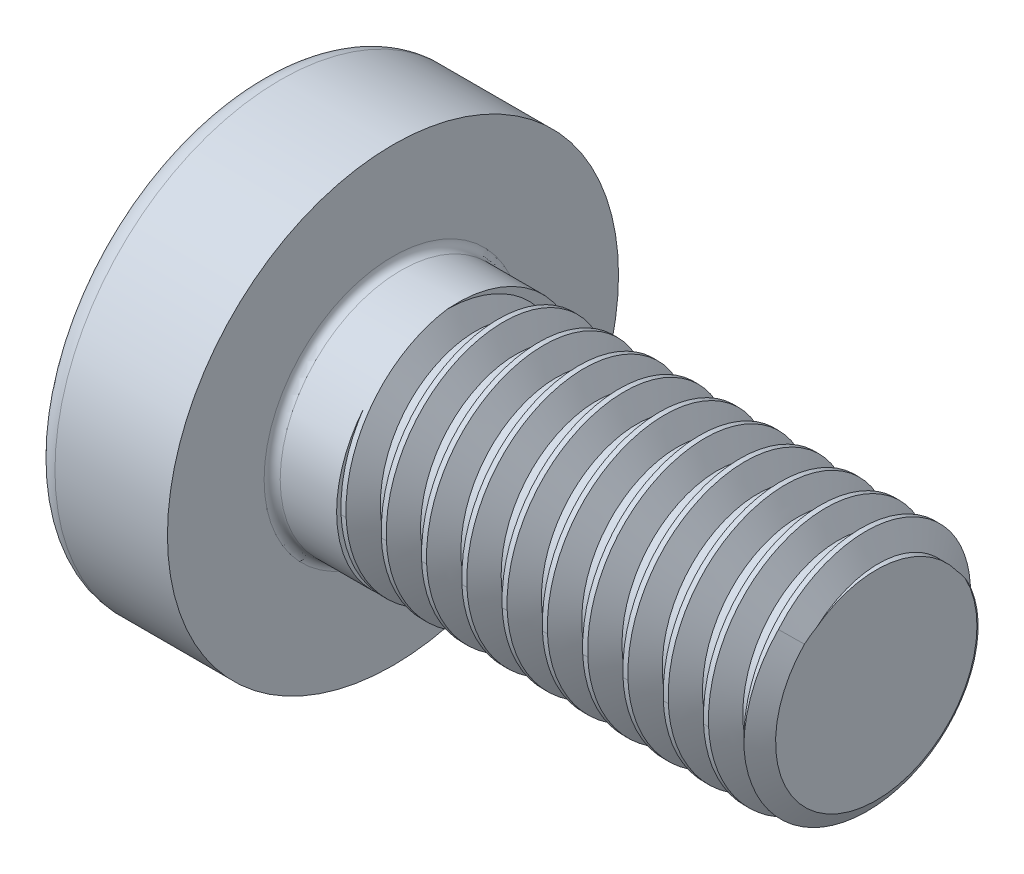
from build123d import *

# Parameters (mm, degrees)
FILLET1_R           = 0.1
CIRPATTERN1_COUNT   = 2
CIRPATTERN1_ANGLE   = 90.0000000000002
CHAMFER1_SIZE       = 0.25
CHAMFER1_SIZE2      = 0.14433756729740682
THREAD1_PITCH       = 0.5
BOSS_EXTRUDE1_START = 0.8
SKETCH8_R           = 1.5
BOSS_EXTRUDE1_DEPTH = 0.8


with BuildPart() as part:
    # Sketch2 → Revolve1 (revolve)
    with BuildSketch(Plane.XZ):
        with BuildLine():
            Line((0, 0), (-8.4, -1.08e-15))
            ThreePointArc((-8.4, -1.08e-15), (-8.20224645376158, 1.3922747564092113), (-7.624628401066268, 2.6744186046511635))
            ThreePointArc((-7.624628401066268, 2.6744186046511635), (-7.5267040293947, 2.766530149511446), (-7.396498467408688, 2.8))
            Line((-7.396498467408688, 2.8), (-6, 2.8000000000000003))
            Line((-6, 2.8000000000000003), (-6, 1.4999999999999991))
            Line((-6, 1.4999999999999991), (0, 1.5))
            Line((0, 1.5), (0, 0))
        make_face()
    revolve(axis=Axis((-2.352039512005497, 0, 0), (1, 0, 0)))

    # Fillet1
    fillet1_edges = [part.edges().sort_by_distance(p)[0] for p in [
        (-6, -1.8e-16, -1.4999999999999991),
    ]]
    fillet(fillet1_edges, radius=FILLET1_R)

    # Sketch3 → Cut-Loft1 section 0
    with BuildSketch(Plane(origin=(-8.4, 0, 0), x_dir=(0, 0, -1), z_dir=(1, 0, 0))):
        with BuildLine():
            Line((-0.3700000000000001, 1.4), (0.3699999999999999, 1.4))
            Line((0.3699999999999999, 1.4), (0.3700000000000002, -1.4))
            Line((0.3700000000000002, -1.4), (-0.3699999999999998, -1.4))
            Line((-0.3699999999999998, -1.4), (-0.3700000000000001, 1.4))
        make_face()
    # Sketch4 → Cut-Loft1 section 1
    with BuildSketch(Plane(origin=(-6.6499999999999995, 0, 0), x_dir=(0, 0, -1), z_dir=(1, 0, 0))):
        with BuildLine():
            Line((0.3699999999999999, -0.5274999999999999), (-0.3700000000000001, -0.5275))
            Line((-0.3700000000000001, -0.5275), (-0.3700000000000001, 0.5275))
            Line((-0.3700000000000001, 0.5275), (0.3699999999999999, 0.5275))
            Line((0.3699999999999999, 0.5275), (0.3699999999999999, -0.5274999999999999))
        make_face()
    cut_loft1 = loft(mode=Mode.SUBTRACT)

    # CirPattern1: Cut-Loft1 ×2 about axis
    cirpattern1_axis = Axis((0, 0, 0), (-1, 0, 0))
    for i in range(1, CIRPATTERN1_COUNT):
        add(cut_loft1.rotate(cirpattern1_axis, i * CIRPATTERN1_ANGLE / (CIRPATTERN1_COUNT - 1)), mode=Mode.SUBTRACT)

    # Sketch5 → Cut-Revolve1 (revolve, cut)
    with BuildSketch(Plane.XY, mode=Mode.PRIVATE) as cut_revolve1_sk:
        Polygon((-8.4, 0.67837192), (-8.4, 0), (-6.469344649187304, 0), (-6.650000000000001, 0.5559999990988693), align=None)
    revolve(cut_revolve1_sk.sketch.rotate(Axis((-8.4, 0, 0), (1, 0, 0)), 90), axis=Axis((-8.4, 0, 0), (1, 0, 0)), mode=Mode.SUBTRACT)

    # Chamfer1
    chamfer1_edges = [part.edges().sort_by_distance(p)[0] for p in [
        (0, -1.8e-16, -1.5),
    ]]
    chamfer1_side = [part.faces().sort_by_distance(p)[0] for p in [
        (0, 1e-16, 6.7e-16),
    ]]
    chamfer(chamfer1_edges, length=CHAMFER1_SIZE, length2=CHAMFER1_SIZE2, reference=chamfer1_side[0])

    # Thread1: the profile of Thread Profile1 profile screwed along a right-hand helix of 14.591325 turns, 6 arcs to a turn; built about Z, then put on its axis
    thread1_z = Axis((0, 0, 0), (0, 0, 1))
    thread1_corners = [(1.5003, 0, -0.000173205), (1.5003, 0, 0.437673204), (1.229367062, 0, 0.28125), (1.229367062, 0, 0.15625)]
    with BuildLine(mode=Mode.PRIVATE) as thread1_profile:
        Line(thread1_corners[0], thread1_corners[1])
        Line(thread1_corners[1], thread1_corners[2])
        Line(thread1_corners[2], thread1_corners[3])
        Line(thread1_corners[3], thread1_corners[0])
    thread1_cap = Face(thread1_profile.wire())
    thread1_turn_angles = [0, 30, 60, 90, 120, 150, 180, 210, 240, 270, 300, 330, 360]
    thread1_turn_weights = [1, 0.8660254037844387, 1, 0.8660254037844387, 1, 0.8660254037844387, 1, 0.8660254037844387, 1, 0.8660254037844387, 1, 0.8660254037844387, 1]
    thread1_turn_rails = [Edge.make_bspline([Vector(p[0], p[1], 0).rotate(thread1_z, thread1_turn_angles[k]) / thread1_turn_weights[k] + Vector(0, 0, p[2] + THREAD1_PITCH * thread1_turn_angles[k] / 360) for k in range(13)], [0, 0, 0, 1, 1, 2, 2, 3, 3, 4, 4, 5, 5, 6, 6, 6], 2, thread1_turn_weights) for p in thread1_corners]
    thread1_turn_sides = [Face.make_surface_from_curves(thread1_turn_rails[p[0]], thread1_turn_rails[p[1]]) for p in [(0, 1), (1, 2), (2, 3), (3, 0)]]
    thread1_last_angles = [5040, 5070, 5100, 5130, 5160, 5190, 5220, 5236.438475773, 5252.876951546]
    thread1_last_weights = [1, 0.8660254037844387, 1, 0.8660254037844387, 1, 0.8660254037844387, 1, 0.9591241577989041, 1]
    thread1_last_rails = [Edge.make_bspline([Vector(p[0], p[1], 0).rotate(thread1_z, thread1_last_angles[k]) / thread1_last_weights[k] + Vector(0, 0, p[2] + THREAD1_PITCH * thread1_last_angles[k] / 360) for k in range(9)], [0, 0, 0, 1, 1, 2, 2, 3, 3, 4, 4, 4], 2, thread1_last_weights) for p in thread1_corners]
    thread1_last_sides = [Face.make_surface_from_curves(thread1_last_rails[p[0]], thread1_last_rails[p[1]]) for p in [(0, 1), (1, 2), (2, 3), (3, 0)]]
    thread1 = Plane(origin=(1.855662433, 0, 0), x_dir=(0, 0, 1), z_dir=(-1, 0, 0)) * Solid(Shell([*[p.moved(Location((0, 0, THREAD1_PITCH * i))) for i in range(14) for p in thread1_turn_sides], *thread1_last_sides, thread1_cap, thread1_cap.rotate(thread1_z, 5252.876951546).moved(Location((0, 0, THREAD1_PITCH * 5252.876951546 / 360)))]))
    add(thread1, mode=Mode.SUBTRACT)

    # Sketch8 → Boss-Extrude1 (add)
    with BuildSketch(Plane(origin=(-6, 0, 0), x_dir=(0, 0, -1), z_dir=(1, 0, 0)).offset(BOSS_EXTRUDE1_START)):
        with Locations(Location((0, 0, 0), (0, 0, 180))):
            Circle(SKETCH8_R)
    extrude(amount=-BOSS_EXTRUDE1_DEPTH)


solid = part.part
